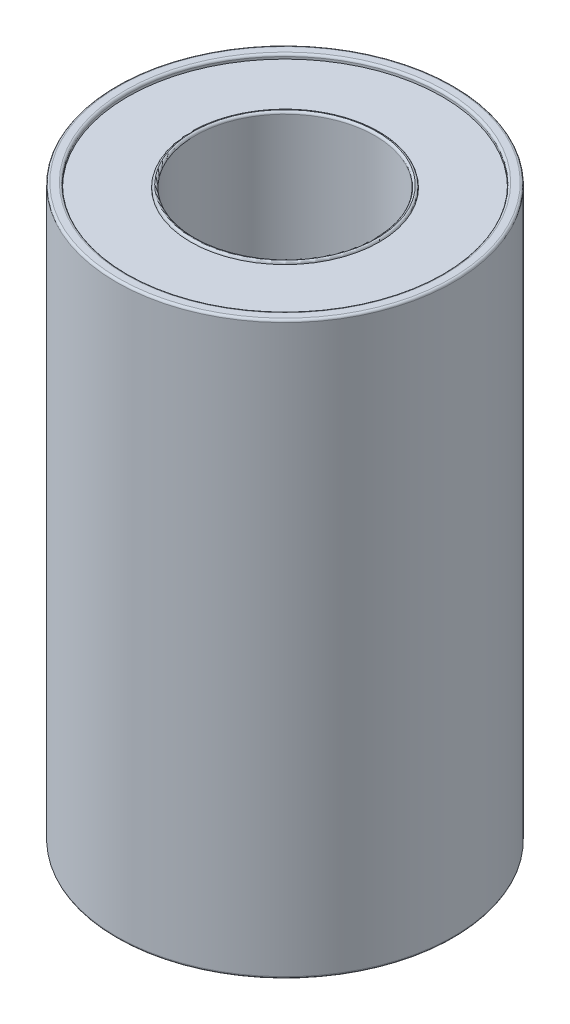
from build123d import *

# Parameters (mm, degrees)
SKETCH1_R            = 7
BOSS_EXTRUDE1_DEPTH  = 12.5
SKETCH2_R            = 4
CUT_EXTRUDE1_DEPTH   = 25
BOSS_EXTRUDE2_START  = 0.1
SKETCH3_R            = 4.2
SKETCH3_R_2          = 4
BOSS_EXTRUDE2_DEPTH  = 0.1
FILLET1_R            = 0.1
FILLET1_OF_MIRROR1_R = 0.1
SKETCH4_R            = 7.5
SKETCH4_R_2          = 7
BOSS_EXTRUDE4_DEPTH  = 12.7
FILLET2_R            = 0.1
FILLET3_R            = 0.1


with BuildPart() as part:
    # Sketch1 → Boss-Extrude1 (new, symmetric)
    with BuildSketch(Plane(origin=(0, 0, 0), x_dir=(1, 0, 0), z_dir=(0, 1, 0))):
        with Locations(Location((0, 0, 0), (0, 0, 270))):
            Circle(SKETCH1_R)
    extrude(amount=BOSS_EXTRUDE1_DEPTH, both=True)

    # Sketch2 → Cut-Extrude1 (cut)
    with BuildSketch(Plane(origin=(0, 12.5, 0), x_dir=(1, 0, 0), z_dir=(0, 1, 0))):
        with Locations(Location((0, 0, 0), (0, 0, 270))):
            Circle(SKETCH2_R)
    extrude(amount=-CUT_EXTRUDE1_DEPTH, mode=Mode.SUBTRACT)

    # Sketch3 → Boss-Extrude2 (add)
    with BuildSketch(Plane(origin=(0, 12.5, 0), x_dir=(1, 0, 0), z_dir=(0, 1, 0)).offset(BOSS_EXTRUDE2_START)):
        with Locations(Location((0, 0, 0), (0, 0, 270))):
            Circle(SKETCH3_R)
        with Locations(Location((0, 0, 0), (0, 0, 270))):
            Circle(SKETCH3_R_2, mode=Mode.SUBTRACT)
    boss_extrude2 = extrude(amount=-BOSS_EXTRUDE2_DEPTH)

    # Fillet1
    fillet1_edges = [part.edges().sort_by_distance(p)[0] for p in [
        (0, 12.6, -4.2),
        (0, 12.6, -4),
    ]]
    fillet(fillet1_edges, radius=FILLET1_R - 0.0001)  # a hair under: the kernel refuses the full size

    # Mirror1: Boss-Extrude2 across plane
    add(boss_extrude2.mirror(Plane.ZX))

    # Fillet1 of Mirror1
    fillet1_of_mirror1_edges = [part.edges().sort_by_distance(p)[0] for p in [
        (0, -12.6, -4.2),
        (0, -12.6, -4),
    ]]
    fillet(fillet1_of_mirror1_edges, radius=FILLET1_OF_MIRROR1_R - 0.0001)  # a hair under: the kernel refuses the full size

    # Sketch4 → Boss-Extrude4 (add, symmetric)
    with BuildSketch(Plane(origin=(0, 0, 0), x_dir=(1, 0, 0), z_dir=(0, 1, 0))):
        with Locations(Location((0, 0, 0), (0, 0, 270))):
            Circle(SKETCH4_R)
        with Locations(Location((0, 0, 0), (0, 0, 270))):
            Circle(SKETCH4_R_2, mode=Mode.SUBTRACT)
    extrude(amount=BOSS_EXTRUDE4_DEPTH, both=True)

    # Fillet2
    fillet2_edges = [part.edges().sort_by_distance(p)[0] for p in [
        (0, 12.7, -7.5),
        (0, 12.7, -7),
    ]]
    fillet(fillet2_edges, radius=FILLET2_R)

    # Fillet3
    fillet3_edges = [part.edges().sort_by_distance(p)[0] for p in [
        (0, -12.7, -7),
        (0, -12.7, -7.5),
    ]]
    fillet(fillet3_edges, radius=FILLET3_R)


solid = part.part
